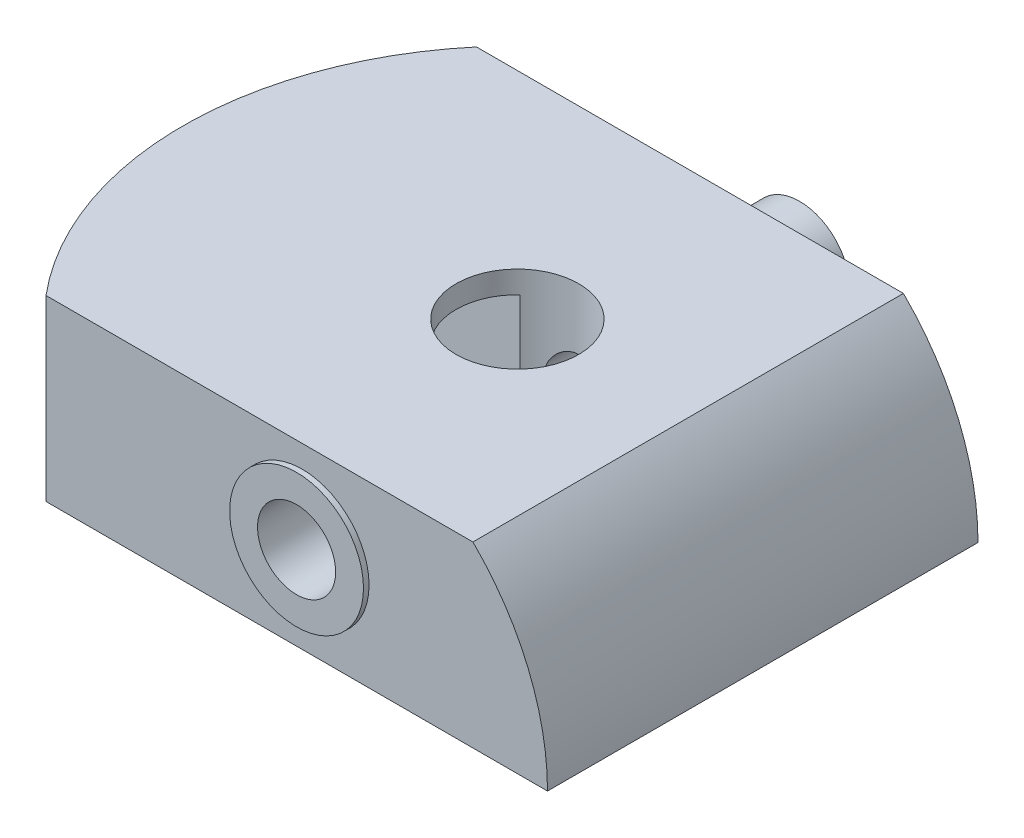
from build123d import *

# Parameters (mm, degrees)
BOSS_EXTRUDE1_DEPTH        = 19.3
POT_START                  = -4
POT_INSERT_DEPTH           = 2.5
POT_START_2                = 4
SKETCH6_R                  = 2.75
POT_HOLE_DEPTH             = 40.387513448
SKETCH8_R                  = 2.25
BOSS_EXTRUDE2_DEPTH        = 3
BOSS_EXTRUDE4_START        = 19.3
SKETCH18_R                 = 3
BOSS_EXTRUDE4_DEPTH        = 0.25
BOSS_EXTRUDE3_START        = -0.25
SKETCH17_R                 = 3
BOSS_EXTRUDE3_DEPTH        = 0.25
ABDUCTION_START            = 4
ABDUCTION_CURVE_DEPTH      = 40.524478998
ABDUCTION_START_2          = 11
SKETCH13_R                 = 1.75
ABDUCTION_CABLE_HOLE_DEPTH = 9
FLEX_EXTEND_CURVE_DEPTH    = 36.524479064
CUT_EXTRUDE1_START         = -1.5
SKETCH15_W                 = 9
SKETCH15_H                 = 4
CUT_EXTRUDE1_DEPTH         = 4.5
SKETCH16_R                 = 1.25
CUT_EXTRUDE2_DEPTH         = 38.259745213


with BuildPart() as part:
    # Sketch1 → Boss-Extrude1 (new body)
    with BuildSketch(Plane.XY):
        Polygon((1.390238312, 4), (1.390238312, -4), (18.390238312, -4), (29.390238312, -4), (29.390238312, 4), align=None)
    extrude(amount=BOSS_EXTRUDE1_DEPTH)

    # Sketch5 → Pot Insert (cut)
    with BuildSketch(Plane(origin=(0, 0, 0), x_dir=(1, 0, 0), z_dir=(0, 1, 0)).offset(POT_START)):
        Polygon((23.890238312, -11.15), (23.890238312, -8.15), (22.390238312, -5.15), (22.390238312, -4.15), (18.390238312, -4.15), (14.140238312, -4.15), (14.140238312, -5.15), (8.890238312, -5.15), (1.390238312, -5.15), (1.390238312, -9.15), (1.390238312, -14.15), (8.890238312, -14.15), (14.140238312, -14.15), (14.140238312, -15.15), (18.390238312, -15.15), (22.390238312, -15.15), (22.390238312, -14.15), align=None)
    extrude(amount=POT_INSERT_DEPTH, mode=Mode.SUBTRACT)

    # Sketch6 → Pot Hole (cut, through all)
    with BuildSketch(Plane(origin=(0, 0, 0), x_dir=(1, 0, 0), z_dir=(0, 1, 0)).offset(POT_START_2)):
        with Locations((18.390238312, -9.65)):
            Circle(SKETCH6_R)
    extrude(amount=-POT_HOLE_DEPTH, mode=Mode.SUBTRACT)

    # Sketch8 → Boss-Extrude2 (add)
    with BuildSketch(Plane.XY):
        with Locations((18.390238312, 0)):
            Circle(SKETCH8_R)
    extrude(amount=-BOSS_EXTRUDE2_DEPTH)

    # Sketch18 → Boss-Extrude4 (add)
    with BuildSketch(Plane.XY.offset(BOSS_EXTRUDE4_START)):
        with Locations((18.390238312, 0)):
            Circle(SKETCH18_R)
    extrude(amount=BOSS_EXTRUDE4_DEPTH)

    # Sketch17 → Boss-Extrude3 (add)
    with BuildSketch(Plane.XY.offset(BOSS_EXTRUDE3_START)):
        with Locations((18.390238312, 0)):
            Circle(SKETCH17_R)
    extrude(amount=BOSS_EXTRUDE3_DEPTH)

    # Sketch7 → Abduction Curve (cut, through all)
    with BuildSketch(Plane(origin=(0, 0, 0), x_dir=(1, 0, 0), z_dir=(0, 1, 0)).offset(ABDUCTION_START)):
        with BuildLine():
            Line((1.390238312, -24.65), (18.390238312, -24.65))
            ThreePointArc((18.390238312, -24.65), (3.390238312, -9.65), (18.390238312, 5.35))
            Line((18.390238312, 5.35), (1.390238312, 5.35))
            Line((1.390238312, 5.35), (1.390238312, -24.65))
        make_face()
    extrude(amount=-ABDUCTION_CURVE_DEPTH, mode=Mode.SUBTRACT)

    # Sketch13 → Abduction Cable Hole (cut)
    with BuildSketch(Plane.XY.offset(ABDUCTION_START_2)):
        with Locations((18.390238312, 0)):
            Circle(SKETCH13_R)
    extrude(amount=ABDUCTION_CABLE_HOLE_DEPTH, mode=Mode.SUBTRACT)

    # Sketch14 → Flex-Extend Curve (cut, through all)
    with BuildSketch(Plane.XY):
        with BuildLine():
            Line((29.390238312, 7.241896464), (18.148341849, 7.241896464))
            ThreePointArc((18.148341849, 7.241896464), (26.097563072, 3.949221223), (29.390238312, -4))
            Line((29.390238312, -4), (29.390238312, 7.241896464))
        make_face()
    extrude(amount=FLEX_EXTEND_CURVE_DEPTH, mode=Mode.SUBTRACT)

    # Sketch15 → Cut-Extrude1 (cut)
    with BuildSketch(Plane(origin=(0, 0, 0), x_dir=(1, 0, 0), z_dir=(0, 1, 0)).offset(CUT_EXTRUDE1_START)):
        with Locations((13.890238312, -9.65)):
            Rectangle(SKETCH15_W, SKETCH15_H)
    extrude(amount=CUT_EXTRUDE1_DEPTH, mode=Mode.SUBTRACT)

    # Sketch16 → Cut-Extrude2 (cut, through all)
    with BuildSketch(Plane(origin=(0, 0, -3), x_dir=(-1, 0, 0), z_dir=(0, 0, -1))):
        with Locations((-18.390238312, 0)):
            Circle(SKETCH16_R)
    extrude(amount=-CUT_EXTRUDE2_DEPTH, mode=Mode.SUBTRACT)


solid = part.part
